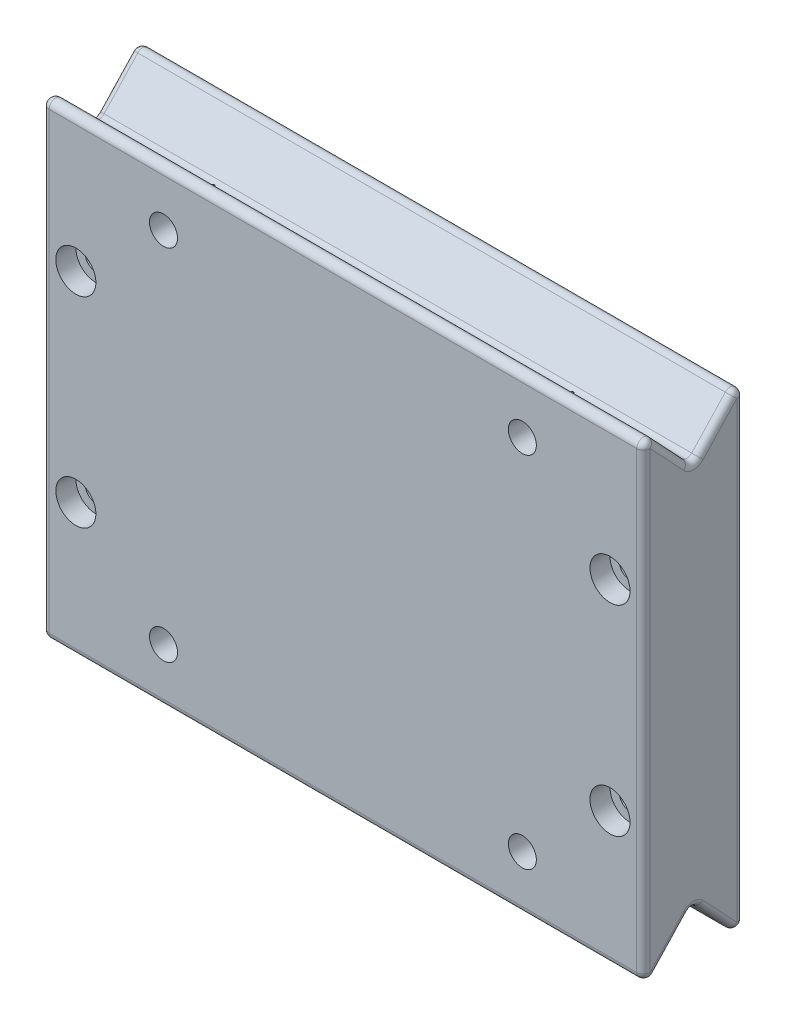
from build123d import *

# Parameters (mm, degrees)
SKETCH_1_W          = 90
SKETCH_1_H          = 73
SKETCH_1_R          = 2.1
EXTRUDE_1_DEPTH     = 15
SKETCH_2_R          = 4.5
CUT_EXTRUDE_1_DEPTH = 3
CUT_EXTRUDE_4_DEPTH = 99.271308122
SKETCH_6_R          = 1.6
CUT_EXTRUDE_5_DEPTH = 60.851900555
SKETCH_7_R          = 3
CUT_EXTRUDE_6_DEPTH = 3
FILLET_5_R          = 1
FILLET_6_R          = 1
FILLET_7_R          = 1
FILLET_8_R          = 1


with BuildPart() as part:
    # 草图1 → 凸台-拉伸1 (new body)
    with BuildSketch(Plane.XY):
        Rectangle(SKETCH_1_W, SKETCH_1_H)
        with Locations((-26.87, 26.87)):
            Circle(SKETCH_1_R, mode=Mode.SUBTRACT)
        with Locations(Location((26.87, 26.87, 0), (0, 0, 180))):
            Circle(SKETCH_1_R, mode=Mode.SUBTRACT)
        with Locations((26.87, -26.87)):
            Circle(SKETCH_1_R, mode=Mode.SUBTRACT)
        with Locations(Location((-26.87, -26.87, 0), (0, 0, 180))):
            Circle(SKETCH_1_R, mode=Mode.SUBTRACT)
    extrude(amount=EXTRUDE_1_DEPTH)

    # 草图2 → 切除-拉伸1 (cut)
    with BuildSketch(Plane(origin=(0, 0, 0), x_dir=(-1, 0, 0), z_dir=(0, 0, -1))):
        with Locations((-26.87, 26.87)):
            Circle(SKETCH_2_R)
        with Locations(Location((26.87, 26.87, 0), (0, 0, 180))):
            Circle(SKETCH_2_R)
        with Locations((26.87, -26.87)):
            Circle(SKETCH_2_R)
        with Locations(Location((-26.87, -26.87, 0), (0, 0, 180))):
            Circle(SKETCH_2_R)
    extrude(amount=-CUT_EXTRUDE_1_DEPTH, mode=Mode.SUBTRACT)

    # 草图5 → 切除-拉伸4 (cut, through all)
    with BuildSketch(Plane.ZY.offset(45)):
        Polygon((0, 36.5), (7.5, 28.5), (15, 36.5), align=None)
        Polygon((0, -36.5), (7.5, -28.5), (15, -36.5), align=None)
    extrude(amount=-CUT_EXTRUDE_4_DEPTH, mode=Mode.SUBTRACT)

    # 草图6 → 切除-拉伸5 (cut, through all)
    with BuildSketch(Plane.XY.offset(15)):
        with Locations((-40, 15)):
            Circle(SKETCH_6_R)
        with Locations(Location((-40, -15, 0), (0, 0, 180))):
            Circle(SKETCH_6_R)
        with Locations((40, -15)):
            Circle(SKETCH_6_R)
        with Locations(Location((40, 15, 0), (0, 0, 180))):
            Circle(SKETCH_6_R)
    extrude(amount=-CUT_EXTRUDE_5_DEPTH, mode=Mode.SUBTRACT)

    # 草图7 → 切除-拉伸6 (cut)
    with BuildSketch(Plane.XY.offset(15)):
        with Locations((-40, 15)):
            Circle(SKETCH_7_R)
        with Locations(Location((-40, -15, 0), (0, 0, 180))):
            Circle(SKETCH_7_R)
        with Locations((40, -15)):
            Circle(SKETCH_7_R)
        with Locations(Location((40, 15, 0), (0, 0, 180))):
            Circle(SKETCH_7_R)
    extrude(amount=-CUT_EXTRUDE_6_DEPTH, mode=Mode.SUBTRACT)

    # 圆角5
    # the kernel refuses this fillet: 1 mm, written as the material it adds along each edge
    with BuildSketch(Plane(origin=(-45, -28.5, 7.5), x_dir=(0, -0.7295372041400846, -0.6839411288813302), z_dir=(1, 0, 0))) as fillet_5_piece_1_section:
        with BuildLine():
            CenterArc((FILLET_5_R * 1.06666666667, -FILLET_5_R), FILLET_5_R, 90, 93.695220532)
            Line((FILLET_5_R * 0.0687456687457, -FILLET_5_R * 1.06444906445), (0, 0))
            Line((0, 0), (FILLET_5_R * 1.06666666667, 0))
        make_face()
    fillet_5_piece_1 = extrude(amount=19.47261984, mode=Mode.PRIVATE)
    fillet_5_piece_1 = fillet_5_piece_1 - Plane(origin=(-26.87, -26.87, 7.500000002), x_dir=(-1, 0, 0), z_dir=(0, 0, -1)) * Cylinder(2.1, 44, mode=Mode.PRIVATE)
    add(fillet_5_piece_1)
    with BuildSketch(Plane(origin=(25.52738016, -28.5, 7.5), x_dir=(0, -0.7295372041400846, -0.6839411288813302), z_dir=(1, 0, 0))) as fillet_5_piece_2_section:
        with BuildLine():
            CenterArc((FILLET_5_R * 1.06666666667, -FILLET_5_R), FILLET_5_R, 90, 93.695220532)
            Line((FILLET_5_R * 0.0687456687457, -FILLET_5_R * 1.06444906445), (0, 0))
            Line((0, 0), (FILLET_5_R * 1.06666666667, 0))
        make_face()
    fillet_5_piece_2 = extrude(amount=19.47261984, mode=Mode.PRIVATE)
    fillet_5_piece_2 = fillet_5_piece_2 - Plane(origin=(26.87, -26.87, 7.500000002), x_dir=(1, 0, 0), z_dir=(0, 0, -1)) * Cylinder(2.1, 44, mode=Mode.PRIVATE)
    add(fillet_5_piece_2)
    with BuildSketch(Plane(origin=(-28.21261984, -28.5, 7.5), x_dir=(0, -0.7295372041400846, -0.6839411288813302), z_dir=(1, 0, 0))) as fillet_5_piece_3_section:
        with BuildLine():
            CenterArc((FILLET_5_R * 1.06666666667, -FILLET_5_R), FILLET_5_R, 90, 93.695220532)
            Line((FILLET_5_R * 0.0687456687457, -FILLET_5_R * 1.06444906445), (0, 0))
            Line((0, 0), (FILLET_5_R * 1.06666666667, 0))
        make_face()
    fillet_5_piece_3 = extrude(amount=56.425239679, mode=Mode.PRIVATE)
    fillet_5_piece_3 = fillet_5_piece_3 - Plane(origin=(-26.87, -26.87, 7.500000001), x_dir=(-1, 0, 0), z_dir=(0, 0, -1)) * Cylinder(2.1, 118, mode=Mode.PRIVATE)
    fillet_5_piece_3 = fillet_5_piece_3 - Plane(origin=(26.87, -26.87, 7.500000001), x_dir=(1, 0, 0), z_dir=(0, 0, -1)) * Cylinder(2.1, 118, mode=Mode.PRIVATE)
    add(fillet_5_piece_3)
    # the kernel refuses this fillet: 1 mm, written as the material it takes off along each edge
    with BuildSketch(Plane(origin=(51.321952033, -36.5, 15), x_dir=(0, 1, 0), z_dir=(-1, 0, 0))) as fillet_5_2_piece_1:
        with BuildLine():
            CenterArc((FILLET_5_R * 2.5287808133, FILLET_5_R), FILLET_5_R, 133.152389734, 136.847610266)
            Line((FILLET_5_R * 1.84483968442, FILLET_5_R * 1.72953720414), (0, 0))
            Line((0, 0), (FILLET_5_R * 2.5287808133, 0))
        make_face()
    extrude(amount=102.643904066, mode=Mode.SUBTRACT)
    with BuildSketch(Plane(origin=(51.321952033, -36.5, 0), x_dir=(0, 1, 0), z_dir=(-1, 0, 0))) as fillet_5_2_piece_2:
        with BuildLine():
            CenterArc((FILLET_5_R * 2.5287808133, -FILLET_5_R), FILLET_5_R, 90, 136.847610266)
            Line((FILLET_5_R * 1.84483968442, -FILLET_5_R * 1.72953720414), (0, 0))
            Line((0, 0), (FILLET_5_R * 2.5287808133, 0))
        make_face()
    extrude(amount=102.643904066, mode=Mode.SUBTRACT)

    # 圆角6
    # the kernel refuses this fillet: 1 mm, written as the material it adds along each edge
    with BuildSketch(Plane(origin=(-28.21261984, 28.5, 7.5), x_dir=(0, 0.729537204140085, -0.6839411288813297), z_dir=(1, 0, 0))) as fillet_6_piece_1_section:
        with BuildLine():
            CenterArc((FILLET_6_R * 1.06666666667, FILLET_6_R), FILLET_6_R, 176.304779468, 93.695220532)
            Line((FILLET_6_R * 0.0687456687457, FILLET_6_R * 1.06444906445), (0, 0))
            Line((0, 0), (FILLET_6_R * 1.06666666667, 0))
        make_face()
    fillet_6_piece_1 = extrude(amount=56.425239679, mode=Mode.PRIVATE)
    fillet_6_piece_1 = fillet_6_piece_1 - Plane(origin=(-26.87, 26.87, 7.499999974), x_dir=(1, 0, 0), z_dir=(0, 0, -1)) * Cylinder(2.1, 118, mode=Mode.PRIVATE)
    fillet_6_piece_1 = fillet_6_piece_1 - Plane(origin=(26.87, 26.87, 7.499999974), x_dir=(-1, 0, 0), z_dir=(0, 0, -1)) * Cylinder(2.1, 118, mode=Mode.PRIVATE)
    add(fillet_6_piece_1)
    with BuildSketch(Plane(origin=(-45, 28.5, 7.5), x_dir=(0, 0.7295372041400854, -0.6839411288813294), z_dir=(1, 0, 0))) as fillet_6_piece_2_section:
        with BuildLine():
            CenterArc((FILLET_6_R * 1.06666666667, FILLET_6_R), FILLET_6_R, 176.304779468, 93.695220532)
            Line((FILLET_6_R * 0.0687456687457, FILLET_6_R * 1.06444906445), (0, 0))
            Line((0, 0), (FILLET_6_R * 1.06666666667, 0))
        make_face()
    fillet_6_piece_2 = extrude(amount=19.47261984, mode=Mode.PRIVATE)
    fillet_6_piece_2 = fillet_6_piece_2 - Plane(origin=(-26.87, 26.87, 7.500000011), x_dir=(1, 0, 0), z_dir=(0, 0, -1)) * Cylinder(2.1, 44, mode=Mode.PRIVATE)
    add(fillet_6_piece_2)
    with BuildSketch(Plane(origin=(25.52738016, 28.5, 7.5), x_dir=(0, 0.729537204140085, -0.6839411288813297), z_dir=(1, 0, 0))) as fillet_6_piece_3_section:
        with BuildLine():
            CenterArc((FILLET_6_R * 1.06666666667, FILLET_6_R), FILLET_6_R, 176.304779468, 93.695220532)
            Line((FILLET_6_R * 0.0687456687457, FILLET_6_R * 1.06444906445), (0, 0))
            Line((0, 0), (FILLET_6_R * 1.06666666667, 0))
        make_face()
    fillet_6_piece_3 = extrude(amount=19.47261984, mode=Mode.PRIVATE)
    fillet_6_piece_3 = fillet_6_piece_3 - Plane(origin=(26.87, 26.87, 7.500000017), x_dir=(-1, 0, 0), z_dir=(0, 0, -1)) * Cylinder(2.1, 44, mode=Mode.PRIVATE)
    add(fillet_6_piece_3)
    # the kernel refuses this fillet: 1 mm, written as the material it takes off along each edge
    with BuildSketch(Plane(origin=(-51.321952033, 36.5, 0), x_dir=(0, -1, 0), z_dir=(1, 0, 0)), Plane(origin=(-51.321952033, 36.5, 15), x_dir=(0, -0.7295372041400834, -0.6839411288813316), z_dir=(1, 0, 0))) as fillet_6_2_piece_1:
        with BuildLine():
            CenterArc((FILLET_6_R * 2.5287808133, -FILLET_6_R), FILLET_6_R, 90, 136.847610266)
            Line((FILLET_6_R * 1.84483968442, -FILLET_6_R * 1.72953720414), (0, 0))
            Line((0, 0), (FILLET_6_R * 2.5287808133, 0))
        make_face()
    extrude(amount=102.643904066, mode=Mode.SUBTRACT)

    # 圆角7
    fillet_7_edges = [part.edges().sort_by_distance(p)[0] for p in [
        (45, -31.966666667, 4.25),
        (45, 0, 15),
        (45, -31.966666667, 10.75),
        (45, 0, 0),
        (45, -34.90114854, 14.367738219),
        (45, -34.90114854, 0.632261781),
        (45, -28.962114147, 7.5),
        (45, 31.966666667, 4.25),
        (45, 31.966666667, 10.75),
        (45, 34.90114854, 14.367738219),
        (45, 34.90114854, 0.632261781),
        (45, 28.962114147, 7.5),
    ]]
    fillet(fillet_7_edges, radius=FILLET_7_R)

    # 圆角8
    fillet_8_edges = [part.edges().sort_by_distance(p)[0] for p in [
        (-45, -31.966666667, 4.25),
        (-45, -31.966666667, 10.75),
        (-45, -34.90114854, 14.367738219),
        (-45, -34.90114854, 0.632261781),
        (-45, -28.962114147, 7.5),
        (-45, 31.966666667, 4.25),
        (-45, 0, 0),
        (-45, 0, 15),
        (-45, 31.966666667, 10.75),
        (-45, 34.90114854, 14.367738219),
        (-45, 34.90114854, 0.632261781),
        (-45, 28.962114147, 7.5),
    ]]
    fillet(fillet_8_edges, radius=FILLET_8_R)


solid = part.part
